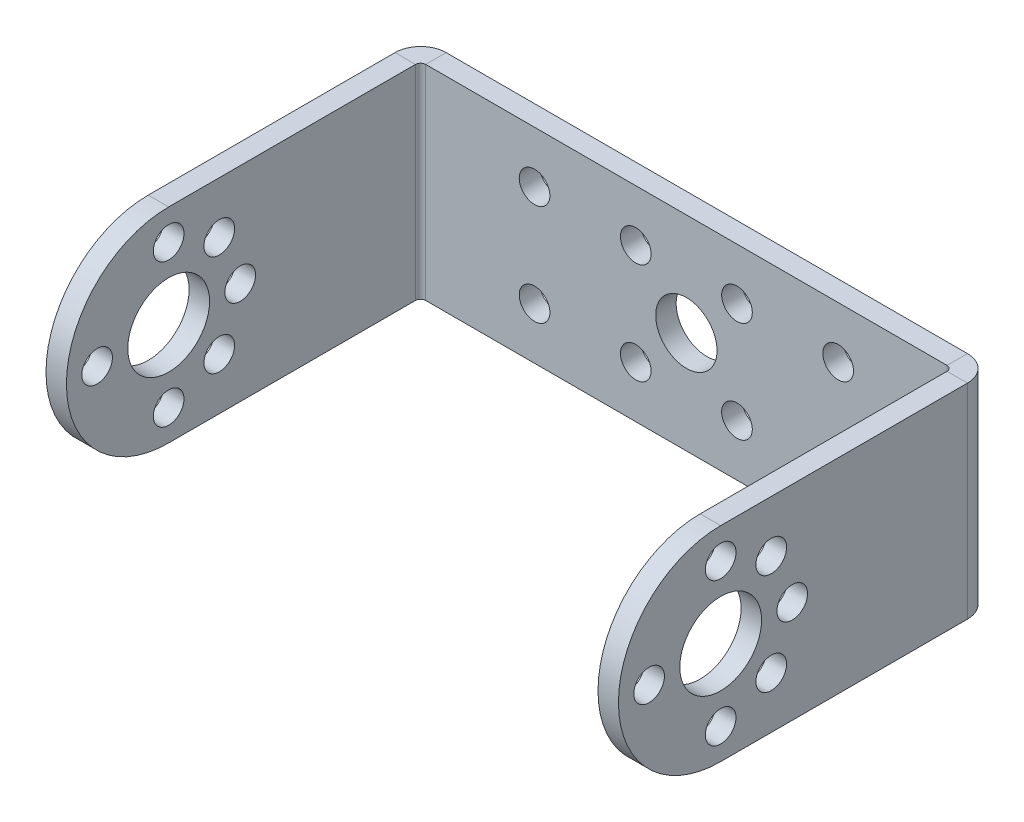
from build123d import *

# Parameters (mm, degrees)
SKETCH1_R                    = 4
SKETCH1_R_2                  = 1.5
EXTRUDE1_DEPTH               = 2
SKETCHED_START               = -63
SKETCHED_BEND1_OUTLINE_W     = 20
SKETCHED_BEND1_OUTLINE_H     = 2
SKETCHED_BEND1_DEPTH         = 35
SKETCHED_START_2             = -27.76405
SKETCHED_BEND1_2_OUTLINE_R   = 1.5
SKETCHED_BEND1_2_OUTLINE_R_2 = 4
SKETCHED_BEND1_2_DEPTH       = 1.76405
SKETCHED_START_3             = -28
SKETCHED_BEND1_3_OUTLINE_R   = 1.5
SKETCHED_BEND1_3_OUTLINE_R_2 = 4
SKETCHED_BEND1_3_DEPTH       = 2.5
SKETCHED_START_4             = -11
SKETCHED_BEND1_4_DEPTH       = 22


with BuildPart() as part:
    # Sketch1 → Extrude1 (new body)
    with BuildSketch(Plane.XY):
        with BuildLine():
            Line((0, -3), (0, -10))
            Line((0, -10), (-52, -10))
            ThreePointArc((-52, -10), (-62, 0), (-52, 10))
            Line((-52, 10), (0, 10))
            Line((0, 10), (0, 3))
            ThreePointArc((0, 3), (-3, 0), (0, -3))
        make_face()
        with Locations((-52, 0)):
            Circle(SKETCH1_R, mode=Mode.SUBTRACT)
        with Locations((-45, 0)):
            Circle(SKETCH1_R_2, mode=Mode.SUBTRACT)
        with Locations((-47.050252532, -4.949747468)):
            Circle(SKETCH1_R_2, mode=Mode.SUBTRACT)
        with Locations((-52, -7)):
            Circle(SKETCH1_R_2, mode=Mode.SUBTRACT)
        with Locations((-59, 0)):
            Circle(SKETCH1_R_2, mode=Mode.SUBTRACT)
        with Locations((-52, 7)):
            Circle(SKETCH1_R_2, mode=Mode.SUBTRACT)
        with Locations((-47.050252532, 4.949747468)):
            Circle(SKETCH1_R_2, mode=Mode.SUBTRACT)
        with Locations((-4.95, -4.95)):
            Circle(SKETCH1_R_2, mode=Mode.SUBTRACT)
        with Locations((-14.85, -4.95)):
            Circle(SKETCH1_R_2, mode=Mode.SUBTRACT)
        with Locations(Location((-4.95, 4.95, 0), (0, 0, 180))):
            Circle(SKETCH1_R_2, mode=Mode.SUBTRACT)
        with Locations(Location((-14.85, 4.95, 0), (0, 0, 180))):
            Circle(SKETCH1_R_2, mode=Mode.SUBTRACT)
    extrude(amount=EXTRUDE1_DEPTH)

    # Sketched Bend1: read off the stored shape, not the designer's step
    # Sketched Bend1 outline → Sketched Bend1 (cut)
    with BuildSketch(Plane.YZ.offset(SKETCHED_START)):
        with Locations((0, 1)):
            Rectangle(SKETCHED_BEND1_OUTLINE_W, SKETCHED_BEND1_OUTLINE_H)
    extrude(amount=SKETCHED_BEND1_DEPTH, mode=Mode.SUBTRACT)

    # Sketched Bend1 2 outline → Sketched Bend1 2 (add)
    with BuildSketch(Plane.YZ.offset(SKETCHED_START_2)):
        with BuildLine():
            Line((10, 2), (10, 26.64380551))
            ThreePointArc((10, 26.64380551), (0, 36.64380551), (-10, 26.64380551))
            Line((-10, 26.64380551), (-10, 2))
            Line((-10, 2), (10, 2))
        make_face()
        with Locations((-7, 26.64380551)):
            Circle(SKETCHED_BEND1_2_OUTLINE_R, mode=Mode.SUBTRACT)
        with Locations((-4.949747468, 21.694058042)):
            Circle(SKETCHED_BEND1_2_OUTLINE_R, mode=Mode.SUBTRACT)
        with Locations((0, 19.64380551)):
            Circle(SKETCHED_BEND1_2_OUTLINE_R, mode=Mode.SUBTRACT)
        with Locations((4.949747468, 21.694058042)):
            Circle(SKETCHED_BEND1_2_OUTLINE_R, mode=Mode.SUBTRACT)
        with Locations((0, 26.64380551)):
            Circle(SKETCHED_BEND1_2_OUTLINE_R_2, mode=Mode.SUBTRACT)
        with Locations((7, 26.64380551)):
            Circle(SKETCHED_BEND1_2_OUTLINE_R, mode=Mode.SUBTRACT)
        with Locations((0, 33.64380551)):
            Circle(SKETCHED_BEND1_2_OUTLINE_R, mode=Mode.SUBTRACT)
    extrude(amount=SKETCHED_BEND1_2_DEPTH)

    # Sketched Bend1 3 outline → Sketched Bend1 3 (add)
    with BuildSketch(Plane.YZ.offset(SKETCHED_START_3)):
        with BuildLine():
            Line((10, 2), (10, 26.64380551))
            ThreePointArc((10, 26.64380551), (0, 36.64380551), (-10, 26.64380551))
            Line((-10, 26.64380551), (-10, 2))
            Line((-10, 2), (10, 2))
        make_face()
        with Locations((-7, 26.64380551)):
            Circle(SKETCHED_BEND1_3_OUTLINE_R, mode=Mode.SUBTRACT)
        with Locations((-4.949747468, 21.694058042)):
            Circle(SKETCHED_BEND1_3_OUTLINE_R, mode=Mode.SUBTRACT)
        with Locations((0, 19.64380551)):
            Circle(SKETCHED_BEND1_3_OUTLINE_R, mode=Mode.SUBTRACT)
        with Locations((4.949747468, 21.694058042)):
            Circle(SKETCHED_BEND1_3_OUTLINE_R, mode=Mode.SUBTRACT)
        with Locations((0, 26.64380551)):
            Circle(SKETCHED_BEND1_3_OUTLINE_R_2, mode=Mode.SUBTRACT)
        with Locations((7, 26.64380551)):
            Circle(SKETCHED_BEND1_3_OUTLINE_R, mode=Mode.SUBTRACT)
        with Locations((0, 33.64380551)):
            Circle(SKETCHED_BEND1_3_OUTLINE_R, mode=Mode.SUBTRACT)
    extrude(amount=SKETCHED_BEND1_3_DEPTH)

    # Sketched Bend1 4 outline → Sketched Bend1 4 (cut)
    with BuildSketch(Plane(origin=(0, 0, 0), x_dir=(1, 0, 0), z_dir=(0, 1, 0)).offset(SKETCHED_START_4)):
        with BuildLine():
            Line((-26, -2.5), (-26, -38))
            Line((-26, -38), (-25.5, -38))
            Line((-25.5, -38), (-25.5, -2))
            ThreePointArc((-25.5, -2), (-25.853553391, -2.146446609), (-26, -2.5))
        make_face()
        with BuildLine():
            Line((-29, -38), (-27.999999998, -38))
            Line((-27.999999998, -38), (-28, -2.5))
            ThreePointArc((-28, -2.5), (-27.267766953, -0.732233047), (-25.5, 0))
            Line((-25.5, 0), (-24, 0))
            Line((-24, 0), (-24, 1))
            Line((-24, 1), (-29, 1))
            Line((-29, 1), (-29, -38))
        make_face()
    extrude(amount=SKETCHED_BEND1_4_DEPTH, mode=Mode.SUBTRACT)

    # Mirror1: part across plane


with BuildPart() as part_1:
    add(part.part)
    add(part.part.mirror(Plane(origin=(0, -3, 2), x_dir=(0, 0, 1), z_dir=(-1, 0, 0))))


solid = part_1.part
